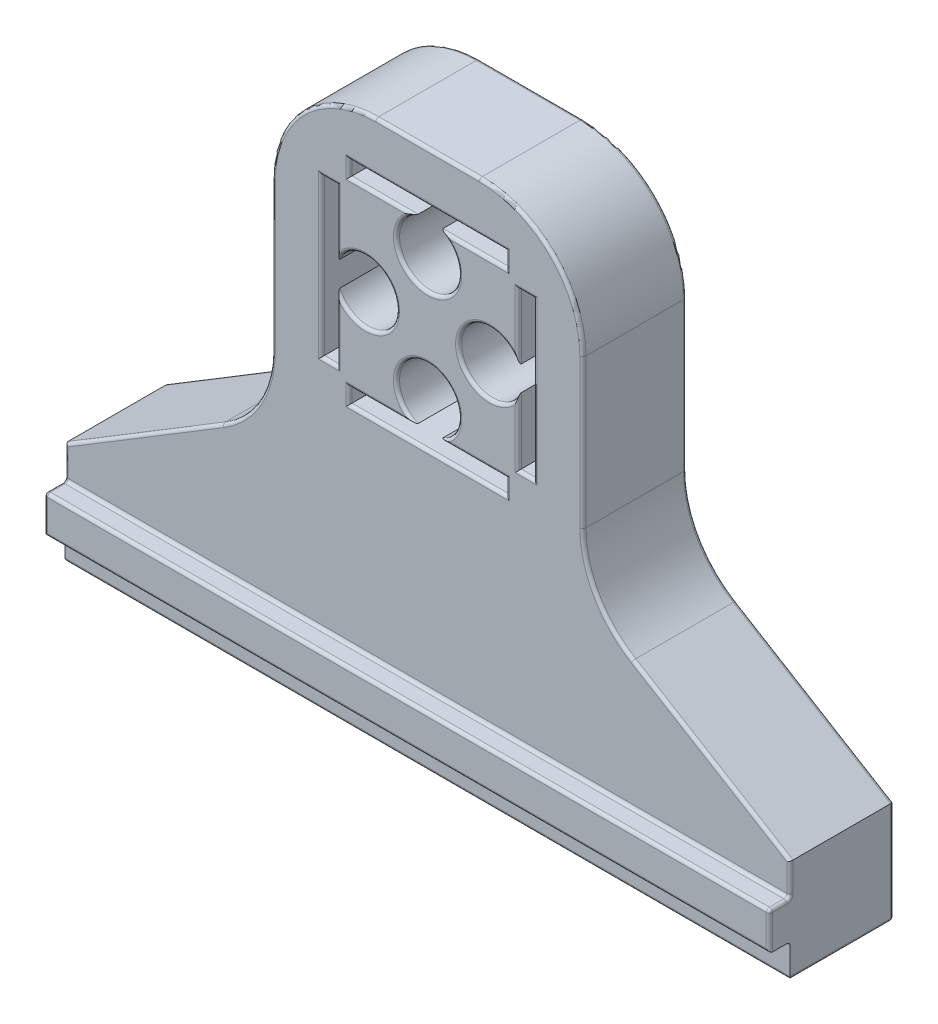
from build123d import *

# Parameters (mm, degrees)
BOSS_EXTRUDE1_DEPTH = 5
BOSS_EXTRUDE2_START = -2
SKETCH4_R           = 2
BOSS_EXTRUDE2_DEPTH = 2
FILLET1_R           = 10
BOSS_EXTRUDE3_DEPTH = 70
FILLET2_R           = 0.3
BOSS_EXTRUDE4_START = 8
BOSS_EXTRUDE4_DEPTH = 8
FILLET3_R           = 0.3
FILLET4_R           = 0.3
FILLET5_R           = 0.3


with BuildPart() as part:
    # Sketch3 → Boss-Extrude1 (new, symmetric)
    with BuildSketch(Plane.XY):
        Polygon((-35, -37.05), (-35, -27.15), (-15, -15), (-15, 15), (15, 15), (15, -15), (35, -27.15), (35, -37.05), align=None)
        with BuildLine():
            ThreePointArc((-8.65, -1.608570794), (-2.9, 0), (-8.65, 1.608570794))
            Line((-8.65, 1.608570794), (-8.65, 7.69))
            Line((-8.65, 7.69), (-10.35, 7.69))
            Line((-10.35, 7.69), (-10.35, -7.69))
            Line((-10.35, -7.69), (-8.65, -7.69))
            Line((-8.65, -7.69), (-8.65, -1.608570794))
        make_face(mode=Mode.SUBTRACT)
        with BuildLine():
            ThreePointArc((-1.608570794, 8.65), (0, 2.9), (1.608570794, 8.65))
            Line((1.608570794, 8.65), (7.69, 8.65))
            Line((7.69, 8.65), (7.69, 10.35))
            Line((7.69, 10.35), (-7.69, 10.35))
            Line((-7.69, 10.35), (-7.69, 8.65))
            Line((-7.69, 8.65), (-1.608570794, 8.65))
        make_face(mode=Mode.SUBTRACT)
        with BuildLine():
            ThreePointArc((8.65, 1.608570794), (2.9, 0), (8.65, -1.608570794))
            Line((8.65, -1.608570794), (8.65, -7.69))
            Line((8.65, -7.69), (10.35, -7.69))
            Line((10.35, -7.69), (10.35, 7.69))
            Line((10.35, 7.69), (8.65, 7.69))
            Line((8.65, 7.69), (8.65, 1.608570794))
        make_face(mode=Mode.SUBTRACT)
        with BuildLine():
            ThreePointArc((1.608570794, -8.65), (0, -2.9), (-1.608570794, -8.65))
            Line((-1.608570794, -8.65), (-7.69, -8.65))
            Line((-7.69, -8.65), (-7.69, -10.35))
            Line((-7.69, -10.35), (7.69, -10.35))
            Line((7.69, -10.35), (7.69, -8.65))
            Line((7.69, -8.65), (1.608570794, -8.65))
        make_face(mode=Mode.SUBTRACT)
    extrude(amount=BOSS_EXTRUDE1_DEPTH, both=True)

    # Sketch4 → Boss-Extrude2 (add)
    # profile 1 of 4: a face of its own
    with BuildSketch(Plane(origin=(0, 0, -5), x_dir=(-1, 0, 0), z_dir=(0, 0, -1)).offset(BOSS_EXTRUDE2_START)):
        with BuildLine():
            Line((7.69, -8.65), (1.608570794, -8.65))
            ThreePointArc((1.608570794, -8.65), (0, -2.9), (-1.608570794, -8.65))
            Line((-1.608570794, -8.65), (-7.69, -8.65))
            Line((-7.69, -8.65), (-7.69, -10.35))
            Line((-7.69, -10.35), (7.69, -10.35))
            Line((7.69, -10.35), (7.69, -8.65))
        make_face()
        with Locations((0, -6)):
            Circle(SKETCH4_R, mode=Mode.SUBTRACT)
    # profile 2 of 4: a face of its own
    with BuildSketch(Plane(origin=(0, 0, -5), x_dir=(-1, 0, 0), z_dir=(0, 0, -1)).offset(BOSS_EXTRUDE2_START)):
        with BuildLine():
            Line((8.65, 7.69), (8.65, 1.608570794))
            ThreePointArc((8.65, 1.608570794), (2.9, 0), (8.65, -1.608570794))
            Line((8.65, -1.608570794), (8.65, -7.69))
            Line((8.65, -7.69), (10.35, -7.69))
            Line((10.35, -7.69), (10.35, 7.69))
            Line((10.35, 7.69), (8.65, 7.69))
        make_face()
        with Locations((6, 0)):
            Circle(SKETCH4_R, mode=Mode.SUBTRACT)
    # profile 3 of 4: a face of its own
    with BuildSketch(Plane(origin=(0, 0, -5), x_dir=(-1, 0, 0), z_dir=(0, 0, -1)).offset(BOSS_EXTRUDE2_START)):
        with BuildLine():
            Line((1.608570794, 8.65), (7.69, 8.65))
            Line((7.69, 8.65), (7.69, 10.35))
            Line((7.69, 10.35), (-7.69, 10.35))
            Line((-7.69, 10.35), (-7.69, 8.65))
            Line((-7.69, 8.65), (-1.608570794, 8.65))
            ThreePointArc((-1.608570794, 8.65), (0, 2.9), (1.608570794, 8.65))
        make_face()
        with Locations((0, 6)):
            Circle(SKETCH4_R, mode=Mode.SUBTRACT)
    # profile 4 of 4: a face of its own
    with BuildSketch(Plane(origin=(0, 0, -5), x_dir=(-1, 0, 0), z_dir=(0, 0, -1)).offset(BOSS_EXTRUDE2_START)):
        with BuildLine():
            Line((-8.65, 1.608570794), (-8.65, 7.69))
            Line((-8.65, 7.69), (-10.35, 7.69))
            Line((-10.35, 7.69), (-10.35, -7.69))
            Line((-10.35, -7.69), (-8.65, -7.69))
            Line((-8.65, -7.69), (-8.65, -1.608570794))
            ThreePointArc((-8.65, -1.608570794), (-2.9, 0), (-8.65, 1.608570794))
        make_face()
        with Locations((-6, 0)):
            Circle(SKETCH4_R, mode=Mode.SUBTRACT)
    extrude(amount=BOSS_EXTRUDE2_DEPTH)

    # Fillet1
    fillet1_edges = [part.edges().sort_by_distance(p)[0] for p in [
        (-15, -15, 0),
        (-15, 15, 0),
        (15, 15, 0),
        (15, -15, 0),
    ]]
    fillet(fillet1_edges, radius=FILLET1_R)

    # Sketch5 → Boss-Extrude3 (add)
    with BuildSketch(Plane(origin=(35, 0, 0), x_dir=(0, 0, -1), z_dir=(1, 0, 0))):
        Polygon((-7, -33.85), (-5, -33.85), (-5, -37.05), (4.9, -37.05), (4.9, -27.15), (-5, -27.15), (-5, -30.25), (-7, -30.25), align=None)
    extrude(amount=-BOSS_EXTRUDE3_DEPTH)

    # Fillet2
    fillet2_edges = [part.edges().sort_by_distance(p)[0] for p in [
        (35, -32.05, 7),
        (0, -33.85, 5),
        (0, -30.25, 5),
        (0, -30.25, 7),
        (-35, -32.05, 7),
        (0, -33.85, 7),
    ]]
    fillet(fillet2_edges, radius=FILLET2_R)

    # Sketch6 → Boss-Extrude4 (add)
    # profile 1 of 4: a face of its own
    with BuildSketch(Plane.XY.offset(-3).offset(BOSS_EXTRUDE4_START)):
        with BuildLine():
            Line((1.608570794, -8.65), (7.69, -8.65))
            Line((7.69, -8.65), (7.69, -10.35))
            Line((7.69, -10.35), (-7.69, -10.35))
            Line((-7.69, -10.35), (-7.69, -8.65))
            Line((-7.69, -8.65), (-1.608570794, -8.65))
            ThreePointArc((-1.608570794, -8.65), (0, -2.9), (1.608570794, -8.65))
        make_face()
        with BuildLine():
            Line((7.59, -8.75), (1.198957881, -8.75))
            ThreePointArc((1.198957881, -8.75), (0, -3), (-1.198957881, -8.75))
            Line((-1.198957881, -8.75), (-7.59, -8.75))
            Line((-7.59, -8.75), (-7.59, -10.25))
            Line((-7.59, -10.25), (7.59, -10.25))
            Line((7.59, -10.25), (7.59, -8.75))
        make_face(mode=Mode.SUBTRACT)
    # profile 2 of 4: a face of its own
    with BuildSketch(Plane.XY.offset(-3).offset(BOSS_EXTRUDE4_START)):
        with BuildLine():
            Line((10.35, 7.69), (8.65, 7.69))
            Line((8.65, 7.69), (8.65, 1.608570794))
            ThreePointArc((8.65, 1.608570794), (2.9, 0), (8.65, -1.608570794))
            Line((8.65, -1.608570794), (8.65, -7.69))
            Line((8.65, -7.69), (10.35, -7.69))
            Line((10.35, -7.69), (10.35, 7.69))
        make_face()
        with BuildLine():
            Line((8.75, 7.59), (8.75, 1.198957881))
            ThreePointArc((8.75, 1.198957881), (3, 0), (8.75, -1.198957881))
            Line((8.75, -1.198957881), (8.75, -7.59))
            Line((8.75, -7.59), (10.25, -7.59))
            Line((10.25, -7.59), (10.25, 7.59))
            Line((10.25, 7.59), (8.75, 7.59))
        make_face(mode=Mode.SUBTRACT)
    # profile 3 of 4: a face of its own
    with BuildSketch(Plane.XY.offset(-3).offset(BOSS_EXTRUDE4_START)):
        with BuildLine():
            Line((7.69, 10.35), (-7.69, 10.35))
            Line((-7.69, 10.35), (-7.69, 8.65))
            Line((-7.69, 8.65), (-1.608570794, 8.65))
            ThreePointArc((-1.608570794, 8.65), (0, 2.9), (1.608570794, 8.65))
            Line((1.608570794, 8.65), (7.69, 8.65))
            Line((7.69, 8.65), (7.69, 10.35))
        make_face()
        with BuildLine():
            Line((-7.59, 8.75), (-1.198957881, 8.75))
            ThreePointArc((-1.198957881, 8.75), (0, 3), (1.198957881, 8.75))
            Line((1.198957881, 8.75), (7.59, 8.75))
            Line((7.59, 8.75), (7.59, 10.25))
            Line((7.59, 10.25), (-7.59, 10.25))
            Line((-7.59, 10.25), (-7.59, 8.75))
        make_face(mode=Mode.SUBTRACT)
    # profile 4 of 4: a face of its own
    with BuildSketch(Plane.XY.offset(-3).offset(BOSS_EXTRUDE4_START)):
        with BuildLine():
            Line((-8.65, 7.69), (-10.35, 7.69))
            Line((-10.35, 7.69), (-10.35, -7.69))
            Line((-10.35, -7.69), (-8.65, -7.69))
            Line((-8.65, -7.69), (-8.65, -1.608570794))
            ThreePointArc((-8.65, -1.608570794), (-2.9, 0), (-8.65, 1.608570794))
            Line((-8.65, 1.608570794), (-8.65, 7.69))
        make_face()
        with BuildLine():
            Line((-8.75, -7.59), (-8.75, -1.198957881))
            ThreePointArc((-8.75, -1.198957881), (-3, 0), (-8.75, 1.198957881))
            Line((-8.75, 1.198957881), (-8.75, 7.59))
            Line((-8.75, 7.59), (-10.25, 7.59))
            Line((-10.25, 7.59), (-10.25, -7.59))
            Line((-10.25, -7.59), (-8.75, -7.59))
        make_face(mode=Mode.SUBTRACT)
    extrude(amount=-BOSS_EXTRUDE4_DEPTH)

    # Fillet3
    fillet3_edges = [part.edges().sort_by_distance(p)[0] for p in [
        (0, -37.05, 5),
        (0, -37.05, -5),
        (35, -37.05, 0),
        (-35, -37.05, 0),
    ]]
    fillet(fillet3_edges, radius=FILLET3_R)

    # Fillet4
    # the kernel refuses this fillet: 0.3 mm, written as the material it takes off along each edge
    with BuildSketch(Plane(origin=(34.7, -36.75, -4.7), x_dir=(0, 0, -1), z_dir=(1, 0, 0))) as fillet4_piece_1_section:
        Polygon((0, 0), (FILLET4_R, 0), (FILLET4_R, -FILLET4_R), (0, -FILLET4_R), align=None)
    fillet4_piece_1 = extrude(amount=FILLET4_R, mode=Mode.PRIVATE)
    fillet4_piece_1 = fillet4_piece_1 - Plane(origin=(34.7, -36.75, -4.7), x_dir=(0, 0.7071067811865475, 0.7071067811865475), z_dir=(1, 0, 0)) * Sphere(FILLET4_R, mode=Mode.PRIVATE)
    add(fillet4_piece_1, mode=Mode.SUBTRACT)
    with BuildSketch(Plane(origin=(-34.7, -36.75, -4.7), x_dir=(-1, 0, 0), z_dir=(0, 0, -1))) as fillet4_piece_2_section:
        Polygon((0, 0), (FILLET4_R, 0), (FILLET4_R, -FILLET4_R), (0, -FILLET4_R), align=None)
    fillet4_piece_2 = extrude(amount=FILLET4_R, mode=Mode.PRIVATE)
    fillet4_piece_2 = fillet4_piece_2 - Plane(origin=(-34.7, -36.75, -4.7), x_dir=(0.7071067811865474, 0.7071067811865476, 0), z_dir=(0, 0, -1)) * Sphere(FILLET4_R, mode=Mode.PRIVATE)
    add(fillet4_piece_2, mode=Mode.SUBTRACT)
    with BuildSketch(Plane(origin=(0, -6, -5), x_dir=(-1, 0, 0), z_dir=(0, -1, 0))) as fillet4_piece_3:
        with BuildLine():
            CenterArc((2 + FILLET4_R, -FILLET4_R), FILLET4_R, 90, 90)
            Line((2, -FILLET4_R), (2, 0))
            Line((2, 0), (2 + FILLET4_R, 0))
        make_face()
    revolve(axis=Axis((0, -6, -5), (0, 0, -1)), mode=Mode.SUBTRACT)
    with BuildSketch(Plane(origin=(-6, 0, -5), x_dir=(-1, 0, 0), z_dir=(0, -1, 0))) as fillet4_piece_4:
        with BuildLine():
            CenterArc((2 + FILLET4_R, -FILLET4_R), FILLET4_R, 90, 90)
            Line((2, -FILLET4_R), (2, 0))
            Line((2, 0), (2 + FILLET4_R, 0))
        make_face()
    revolve(axis=Axis((-6, 0, -5), (0, 0, -1)), mode=Mode.SUBTRACT)
    with BuildSketch(Plane(origin=(0, 6, -5), x_dir=(-1, 0, 0), z_dir=(0, -1, 0))) as fillet4_piece_5:
        with BuildLine():
            CenterArc((2 + FILLET4_R, -FILLET4_R), FILLET4_R, 90, 90)
            Line((2, -FILLET4_R), (2, 0))
            Line((2, 0), (2 + FILLET4_R, 0))
        make_face()
    revolve(axis=Axis((0, 6, -5), (0, 0, -1)), mode=Mode.SUBTRACT)
    with BuildSketch(Plane(origin=(6, 0, -5), x_dir=(-1, 0, 0), z_dir=(0, -1, 0))) as fillet4_piece_6:
        with BuildLine():
            CenterArc((2 + FILLET4_R, -FILLET4_R), FILLET4_R, 90, 90)
            Line((2, -FILLET4_R), (2, 0))
            Line((2, 0), (2 + FILLET4_R, 0))
        make_face()
    revolve(axis=Axis((6, 0, -5), (0, 0, -1)), mode=Mode.SUBTRACT)
    with BuildSketch(Plane(origin=(15, 5, -5), x_dir=(-1, 0, 0), z_dir=(0, -1, 0)), Plane(origin=(-15, -9.374332284, -5), x_dir=(1, 0, 0), z_dir=(0, 1, 0))) as fillet4_piece_7:
        with BuildLine():
            CenterArc((FILLET4_R, -FILLET4_R), FILLET4_R, 90, 90)
            Line((0, -FILLET4_R), (0, 0))
            Line((0, 0), (FILLET4_R, 0))
        make_face()
    extrude(amount=14.374332284, mode=Mode.SUBTRACT)
    with BuildSketch(Plane(origin=(19.807988614, -17.920853083, -5), x_dir=(-0.5192011385553836, -0.854652079926559, 0), z_dir=(0.854652079926559, -0.5192011385553836, 0)), Plane(origin=(-35.64098906, -27.539400854, -5), x_dir=(0.5192011385553845, -0.8546520799265585, 0), z_dir=(0.8546520799265585, 0.5192011385553845, 0))) as fillet4_piece_8:
        with BuildLine():
            CenterArc((FILLET4_R, -FILLET4_R), FILLET4_R, 90, 90)
            Line((0, -FILLET4_R), (0, 0))
            Line((0, 0), (FILLET4_R, 0))
        make_face()
    extrude(amount=18.525667716, mode=Mode.SUBTRACT)
    with BuildSketch(Plane(origin=(-5, 15, -5), x_dir=(0, -1, 0), z_dir=(1, 0, 0))) as fillet4_piece_9:
        with BuildLine():
            CenterArc((FILLET4_R, -FILLET4_R), FILLET4_R, 90, 90)
            Line((0, -FILLET4_R), (0, 0))
            Line((0, 0), (FILLET4_R, 0))
        make_face()
    extrude(amount=10, mode=Mode.SUBTRACT)
    with BuildSketch(Plane(origin=(-5, 5, -5), x_dir=(-1, 0, 0), z_dir=(0, -1, 0))) as fillet4_piece_10:
        with BuildLine():
            CenterArc((10 - FILLET4_R, -FILLET4_R), FILLET4_R, 360, 90)
            Line((10, -FILLET4_R), (10, 0))
            Line((10, 0), (10 - FILLET4_R, 0))
        make_face()
    revolve(axis=Axis((-5, 5, -5), (0, 0, -1)), revolution_arc=90, mode=Mode.SUBTRACT)
    with BuildSketch(Plane(origin=(5, 5, -5), x_dir=(0, 1, 0), z_dir=(-1, 0, 0))) as fillet4_piece_11:
        with BuildLine():
            CenterArc((10 - FILLET4_R, -FILLET4_R), FILLET4_R, 360, 90)
            Line((10, -FILLET4_R), (10, 0))
            Line((10, 0), (10 - FILLET4_R, 0))
        make_face()
    revolve(axis=Axis((5, 5, -5), (0, 0, -1)), revolution_arc=90, mode=Mode.SUBTRACT)
    with BuildSketch(Plane(origin=(25, -9.374332284, -5), x_dir=(-1, 0, 0), z_dir=(0, 1, 0))) as fillet4_piece_12:
        with BuildLine():
            CenterArc((10 + FILLET4_R, FILLET4_R), FILLET4_R, 180, 90)
            Line((10, FILLET4_R), (10, 0))
            Line((10, 0), (10 + FILLET4_R, 0))
        make_face()
    revolve(axis=Axis((25, -9.374332284, -5), (0, 0, 1)), revolution_arc=58.721319306, mode=Mode.SUBTRACT)
    with BuildSketch(Plane(origin=(-25, -9.374332284, -5), x_dir=(0.5192011385553847, -0.8546520799265582, 0), z_dir=(-0.8546520799265582, -0.5192011385553847, 0))) as fillet4_piece_13:
        with BuildLine():
            CenterArc((10 + FILLET4_R, FILLET4_R), FILLET4_R, 180, 90)
            Line((10, FILLET4_R), (10, 0))
            Line((10, 0), (10 + FILLET4_R, 0))
        make_face()
    revolve(axis=Axis((-25, -9.374332284, -5), (0, 0, 1)), revolution_arc=58.721319306, mode=Mode.SUBTRACT)
    with BuildSketch(Plane(origin=(35, -26.4, -5), x_dir=(0, 0, 1), z_dir=(0, -1, 0))) as fillet4_piece_14:
        with BuildLine():
            CenterArc((FILLET4_R, FILLET4_R), FILLET4_R, 180, 90)
            Line((0, FILLET4_R), (0, 0))
            Line((0, 0), (FILLET4_R, 0))
        make_face()
    extrude(amount=10.35, mode=Mode.SUBTRACT)
    with BuildSketch(Plane(origin=(-35, -36.75, -5), x_dir=(1, 0, 0), z_dir=(0, 1, 0))) as fillet4_piece_15:
        with BuildLine():
            CenterArc((FILLET4_R, -FILLET4_R), FILLET4_R, 90, 90)
            Line((0, -FILLET4_R), (0, 0))
            Line((0, 0), (FILLET4_R, 0))
        make_face()
    extrude(amount=10.35, mode=Mode.SUBTRACT)

    # Fillet5
    # the kernel refuses this fillet: 0.3 mm, written as the material it takes off along each edge
    with BuildSketch(Plane(origin=(-34.7, -30.55, 6.7), x_dir=(-1, 0, 0), z_dir=(0, 1, 0))) as fillet5_piece_1_section:
        Polygon((0, 0), (FILLET5_R, 0), (FILLET5_R, FILLET5_R), (0, FILLET5_R), align=None)
    fillet5_piece_1 = extrude(amount=FILLET5_R, mode=Mode.PRIVATE)
    fillet5_piece_1 = fillet5_piece_1 - Plane(origin=(-34.7, -30.55, 6.7), x_dir=(0.7071067811865475, 2.093456611578341e-15, -0.7071067811865475), z_dir=(0, 1, 0)) * Sphere(FILLET5_R, mode=Mode.PRIVATE)
    add(fillet5_piece_1, mode=Mode.SUBTRACT)
    with BuildSketch(Plane(origin=(34.7, -30.55, 6.7), x_dir=(0, 1, 0), z_dir=(1, 0, 0))) as fillet5_piece_2_section:
        Polygon((0, 0), (FILLET5_R, 0), (FILLET5_R, FILLET5_R), (0, FILLET5_R), align=None)
    fillet5_piece_2 = extrude(amount=FILLET5_R, mode=Mode.PRIVATE)
    fillet5_piece_2 = fillet5_piece_2 - Plane(origin=(34.7, -30.55, 6.7), x_dir=(0, -0.7071067811865439, -0.707106781186551), z_dir=(1, 0, 0)) * Sphere(FILLET5_R, mode=Mode.PRIVATE)
    add(fillet5_piece_2, mode=Mode.SUBTRACT)
    with BuildSketch(Plane(origin=(35, -26.4, 5), x_dir=(0, 0, -1), z_dir=(0, -1, 0))) as fillet5_piece_3:
        with BuildLine():
            CenterArc((FILLET5_R, -FILLET5_R), FILLET5_R, 90, 90)
            Line((0, -FILLET5_R), (0, 0))
            Line((0, 0), (FILLET5_R, 0))
        make_face()
    extrude(amount=3.55, mode=Mode.SUBTRACT)
    with BuildSketch(Plane(origin=(15, 5, 5), x_dir=(-1, 0, 0), z_dir=(0, -1, 0)), Plane(origin=(-15, -9.374332284, 5), x_dir=(1, 0, 0), z_dir=(0, 1, 0))) as fillet5_piece_4:
        with BuildLine():
            CenterArc((FILLET5_R, FILLET5_R), FILLET5_R, 180, 90)
            Line((0, FILLET5_R), (0, 0))
            Line((0, 0), (FILLET5_R, 0))
        make_face()
    extrude(amount=14.374332284, mode=Mode.SUBTRACT)
    with BuildSketch(Plane(origin=(19.807988614, -17.920853083, 5), x_dir=(0, 0, -1), z_dir=(0.854652079926559, -0.5192011385553836, 0))) as fillet5_piece_5:
        with BuildLine():
            CenterArc((FILLET5_R, -FILLET5_R), FILLET5_R, 90, 90)
            Line((0, -FILLET5_R), (0, 0))
            Line((0, 0), (FILLET5_R, 0))
        make_face()
    extrude(amount=18.525667716, mode=Mode.SUBTRACT)
    with BuildSketch(Plane(origin=(-5, 15, 5), x_dir=(0, -1, 0), z_dir=(1, 0, 0))) as fillet5_piece_6:
        with BuildLine():
            CenterArc((FILLET5_R, FILLET5_R), FILLET5_R, 180, 90)
            Line((0, FILLET5_R), (0, 0))
            Line((0, 0), (FILLET5_R, 0))
        make_face()
    extrude(amount=10, mode=Mode.SUBTRACT)
    with BuildSketch(Plane(origin=(-35.64098906, -27.539400854, 5), x_dir=(0.5192011385553845, -0.8546520799265585, 0), z_dir=(0.8546520799265585, 0.5192011385553845, 0))) as fillet5_piece_7:
        with BuildLine():
            CenterArc((FILLET5_R, FILLET5_R), FILLET5_R, 180, 90)
            Line((0, FILLET5_R), (0, 0))
            Line((0, 0), (FILLET5_R, 0))
        make_face()
    extrude(amount=18.525667716, mode=Mode.SUBTRACT)
    with BuildSketch(Plane(origin=(-5, 5, 5), x_dir=(-1, 0, 0), z_dir=(0, -1, 0))) as fillet5_piece_8:
        with BuildLine():
            CenterArc((10 - FILLET5_R, FILLET5_R), FILLET5_R, 270, 90)
            Line((10, FILLET5_R), (10, 0))
            Line((10, 0), (10 - FILLET5_R, 0))
        make_face()
    revolve(axis=Axis((-5, 5, 5), (0, 0, -1)), revolution_arc=90, mode=Mode.SUBTRACT)
    with BuildSketch(Plane(origin=(5, 5, 5), x_dir=(0, 1, 0), z_dir=(-1, 0, 0))) as fillet5_piece_9:
        with BuildLine():
            CenterArc((10 - FILLET5_R, FILLET5_R), FILLET5_R, 270, 90)
            Line((10, FILLET5_R), (10, 0))
            Line((10, 0), (10 - FILLET5_R, 0))
        make_face()
    revolve(axis=Axis((5, 5, 5), (0, 0, -1)), revolution_arc=90, mode=Mode.SUBTRACT)
    with BuildSketch(Plane(origin=(25, -9.374332284, 5), x_dir=(-1, 0, 0), z_dir=(0, 1, 0))) as fillet5_piece_10:
        with BuildLine():
            CenterArc((10 + FILLET5_R, -FILLET5_R), FILLET5_R, 90, 90)
            Line((10, -FILLET5_R), (10, 0))
            Line((10, 0), (10 + FILLET5_R, 0))
        make_face()
    revolve(axis=Axis((25, -9.374332284, 5), (0, 0, 1)), revolution_arc=58.721319306, mode=Mode.SUBTRACT)
    with BuildSketch(Plane(origin=(-25, -9.374332284, 5), x_dir=(0.5192011385553847, -0.8546520799265582, 0), z_dir=(-0.8546520799265582, -0.5192011385553847, 0))) as fillet5_piece_11:
        with BuildLine():
            CenterArc((10 + FILLET5_R, -FILLET5_R), FILLET5_R, 90, 90)
            Line((10, -FILLET5_R), (10, 0))
            Line((10, 0), (10 + FILLET5_R, 0))
        make_face()
    revolve(axis=Axis((-25, -9.374332284, 5), (0, 0, 1)), revolution_arc=58.721319306, mode=Mode.SUBTRACT)
    with BuildSketch(Plane(origin=(35, -30.25, 5.3), x_dir=(0, -1, 0), z_dir=(0, 0, 1)), Plane(origin=(-35, -30.25, 5.3), x_dir=(1, 0, 0), z_dir=(0, 0, 1))) as fillet5_piece_12:
        with BuildLine():
            CenterArc((FILLET5_R, -FILLET5_R), FILLET5_R, 90, 90)
            Line((0, -FILLET5_R), (0, 0))
            Line((0, 0), (FILLET5_R, 0))
        make_face()
    extrude(amount=1.4, mode=Mode.SUBTRACT)
    with BuildSketch(Plane(origin=(-35, -29.95, 5), x_dir=(1, 0, 0), z_dir=(0, 1, 0))) as fillet5_piece_13:
        with BuildLine():
            CenterArc((FILLET5_R, FILLET5_R), FILLET5_R, 180, 90)
            Line((0, FILLET5_R), (0, 0))
            Line((0, 0), (FILLET5_R, 0))
        make_face()
    extrude(amount=3.55, mode=Mode.SUBTRACT)
    with BuildSketch(Plane(origin=(35, -29.95, 5.3), x_dir=(0, 0, -1), z_dir=(0, 1, 0))) as fillet5_piece_14:
        with BuildLine():
            CenterArc((0.3 + FILLET5_R, FILLET5_R), FILLET5_R, 180, 90)
            Line((0.3, FILLET5_R), (0.3, 0))
            Line((0.3, 0), (0.3 + FILLET5_R, 0))
        make_face()
    revolve(axis=Axis((35, -29.95, 5.3), (-1, 0, 0)), revolution_arc=90, mode=Mode.SUBTRACT)
    with BuildSketch(Plane(origin=(-35, -29.95, 5.3), x_dir=(0, 0, -1), z_dir=(0, 1, 0))) as fillet5_piece_15:
        with BuildLine():
            CenterArc((0.3 + FILLET5_R, -FILLET5_R), FILLET5_R, 90, 90)
            Line((0.3 + FILLET5_R, 0), (0.3, 0))
            Line((0.3, 0), (0.3, -FILLET5_R))
        make_face()
    revolve(axis=Axis((-35, -29.95, 5.3), (-1, 0, 0)), revolution_arc=90, mode=Mode.SUBTRACT)
    with BuildSketch(Plane(origin=(-7.59, -10.25, 5), x_dir=(0, -1, 0), z_dir=(1, 0, 0)), Plane(origin=(10.25, -7.59, 5), x_dir=(1, 0, 0), z_dir=(0, 1, 0)), Plane(origin=(7.59, 10.25, 5), x_dir=(0, 1, 0), z_dir=(-1, 0, 0)), Plane(origin=(-10.25, 7.59, 5), x_dir=(-1, 0, 0), z_dir=(0, -1, 0))) as fillet5_piece_16:
        with BuildLine():
            CenterArc((FILLET5_R, FILLET5_R), FILLET5_R, 180, 90)
            Line((0, FILLET5_R), (0, 0))
            Line((0, 0), (FILLET5_R, 0))
        make_face()
    extrude(amount=15.18, mode=Mode.SUBTRACT)
    with BuildSketch(Plane(origin=(-7.59, -8.75, 5), x_dir=(-1, 0, 0), z_dir=(0, -1, 0)), Plane(origin=(7.59, -10.25, 5), x_dir=(1, 0, 0), z_dir=(0, 1, 0)), Plane(origin=(8.75, -7.59, 5), x_dir=(0, -1, 0), z_dir=(1, 0, 0)), Plane(origin=(10.25, 7.59, 5), x_dir=(0, 1, 0), z_dir=(-1, 0, 0)), Plane(origin=(7.59, 8.75, 5), x_dir=(1, 0, 0), z_dir=(0, 1, 0)), Plane(origin=(-7.59, 10.25, 5), x_dir=(-1, 0, 0), z_dir=(0, -1, 0)), Plane(origin=(-8.75, 7.59, 5), x_dir=(0, 1, 0), z_dir=(-1, 0, 0)), Plane(origin=(-10.25, -7.59, 5), x_dir=(0, -1, 0), z_dir=(1, 0, 0))) as fillet5_piece_17:
        with BuildLine():
            CenterArc((FILLET5_R, FILLET5_R), FILLET5_R, 180, 90)
            Line((0, FILLET5_R), (0, 0))
            Line((0, 0), (FILLET5_R, 0))
        make_face()
    extrude(amount=1.5, mode=Mode.SUBTRACT)
    with BuildSketch(Plane(origin=(-0.448957881, -8.75, 5), x_dir=(0, 1, 0), z_dir=(-1, 0, 0)), Plane(origin=(7.59, -8.75, 5), x_dir=(0, 1, 0), z_dir=(-1, 0, 0)), Plane(origin=(8.75, -0.448957881, 5), x_dir=(-1, 0, 0), z_dir=(0, -1, 0)), Plane(origin=(8.75, 7.59, 5), x_dir=(-1, 0, 0), z_dir=(0, -1, 0)), Plane(origin=(0.448957881, 8.75, 5), x_dir=(0, -1, 0), z_dir=(1, 0, 0)), Plane(origin=(-7.59, 8.75, 5), x_dir=(0, -1, 0), z_dir=(1, 0, 0)), Plane(origin=(-8.75, 0.448957881, 5), x_dir=(1, 0, 0), z_dir=(0, 1, 0)), Plane(origin=(-8.75, -7.59, 5), x_dir=(1, 0, 0), z_dir=(0, 1, 0))) as fillet5_piece_18:
        with BuildLine():
            CenterArc((FILLET5_R, FILLET5_R), FILLET5_R, 180, 90)
            Line((0, FILLET5_R), (0, 0))
            Line((0, 0), (FILLET5_R, 0))
        make_face()
    extrude(amount=7.141042119, mode=Mode.SUBTRACT)
    with BuildSketch(Plane(origin=(0, -6, 5), x_dir=(0.15923950976873086, -0.9872399802118096, 0), z_dir=(-0.9872399802118096, -0.15923950976873086, 0))) as fillet5_piece_19:
        with BuildLine():
            CenterArc((3 + FILLET5_R, -FILLET5_R), FILLET5_R, 90, 90)
            Line((3, -FILLET5_R), (3, 0))
            Line((3, 0), (3 + FILLET5_R, 0))
        make_face()
    revolve(axis=Axis((0, -6, 5), (0, 0, 1)), revolution_arc=341.674485166, mode=Mode.SUBTRACT)
    with BuildSketch(Plane(origin=(6, 0, 5), x_dir=(0.987239980211885, 0.15923950976826368, 0), z_dir=(0.15923950976826368, -0.987239980211885, 0))) as fillet5_piece_20:
        with BuildLine():
            CenterArc((3 + FILLET5_R, -FILLET5_R), FILLET5_R, 90, 90)
            Line((3, -FILLET5_R), (3, 0))
            Line((3, 0), (3 + FILLET5_R, 0))
        make_face()
    revolve(axis=Axis((6, 0, 5), (0, 0, 1)), revolution_arc=341.674485166, mode=Mode.SUBTRACT)
    with BuildSketch(Plane(origin=(0, 6, 5), x_dir=(-0.15923950976815257, 0.9872399802119028, 0), z_dir=(0.9872399802119028, 0.15923950976815257, 0))) as fillet5_piece_21:
        with BuildLine():
            CenterArc((3 + FILLET5_R, -FILLET5_R), FILLET5_R, 90, 90)
            Line((3, -FILLET5_R), (3, 0))
            Line((3, 0), (3 + FILLET5_R, 0))
        make_face()
    revolve(axis=Axis((0, 6, 5), (0, 0, 1)), revolution_arc=341.674485166, mode=Mode.SUBTRACT)
    with BuildSketch(Plane(origin=(-6, 0, 5), x_dir=(-0.9872399802118278, -0.1592395097686184, 0), z_dir=(-0.1592395097686184, 0.9872399802118278, 0))) as fillet5_piece_22:
        with BuildLine():
            CenterArc((3 + FILLET5_R, -FILLET5_R), FILLET5_R, 90, 90)
            Line((3, -FILLET5_R), (3, 0))
            Line((3, 0), (3 + FILLET5_R, 0))
        make_face()
    revolve(axis=Axis((-6, 0, 5), (0, 0, 1)), revolution_arc=341.674485166, mode=Mode.SUBTRACT)
    with BuildSketch(Plane(origin=(-7.59, -8.75, 5), x_dir=(-1, 0, 0), z_dir=(0, -1, 0))) as fillet5_piece_23a_section:
        with BuildLine():
            CenterArc((FILLET5_R, FILLET5_R), FILLET5_R, 180, 90)
            Line((0, FILLET5_R), (0, 0))
            Line((0, 0), (FILLET5_R, 0))
        make_face()
    fillet5_piece_23a = extrude(amount=2.25, mode=Mode.PRIVATE)
    fillet5_piece_23a = split(fillet5_piece_23a, bisect_by=Plane(origin=(-7.657918534, -10.25, 4.932081466), z_dir=(0, -1, 0)), keep=Keep.TOP, mode=Mode.PRIVATE)
    with BuildSketch(Plane(origin=(-8.34, -10.25, 5), x_dir=(0, -1, 0), z_dir=(1, 0, 0))) as fillet5_piece_23b_section:
        with BuildLine():
            CenterArc((FILLET5_R, FILLET5_R), FILLET5_R, 180, 90)
            Line((0, FILLET5_R), (0, 0))
            Line((0, 0), (FILLET5_R, 0))
        make_face()
    fillet5_piece_23b = extrude(amount=15.93, mode=Mode.PRIVATE)
    fillet5_piece_23b = split(fillet5_piece_23b, bisect_by=Plane(origin=(-7.59, -10.317918534, 4.932081466), z_dir=(-1, 0, 0)), keep=Keep.TOP, mode=Mode.PRIVATE)
    fillet5_piece_23 = fillet5_piece_23a & fillet5_piece_23b
    add(fillet5_piece_23, mode=Mode.SUBTRACT)
    with BuildSketch(Plane(origin=(-7.59, -10.25, 5), x_dir=(0, -1, 0), z_dir=(1, 0, 0))) as fillet5_piece_24a_section:
        with BuildLine():
            CenterArc((FILLET5_R, FILLET5_R), FILLET5_R, 180, 90)
            Line((0, FILLET5_R), (0, 0))
            Line((0, 0), (FILLET5_R, 0))
        make_face()
    fillet5_piece_24a = extrude(amount=15.93, mode=Mode.PRIVATE)
    fillet5_piece_24a = split(fillet5_piece_24a, bisect_by=Plane(origin=(7.59, -10.317918534, 4.932081466), z_dir=(1, 0, 0)), keep=Keep.TOP, mode=Mode.PRIVATE)
    with BuildSketch(Plane(origin=(7.59, -11, 5), x_dir=(1, 0, 0), z_dir=(0, 1, 0))) as fillet5_piece_24b_section:
        with BuildLine():
            CenterArc((FILLET5_R, FILLET5_R), FILLET5_R, 180, 90)
            Line((0, FILLET5_R), (0, 0))
            Line((0, 0), (FILLET5_R, 0))
        make_face()
    fillet5_piece_24b = extrude(amount=2.25, mode=Mode.PRIVATE)
    fillet5_piece_24b = split(fillet5_piece_24b, bisect_by=Plane(origin=(7.657918534, -10.25, 4.932081466), z_dir=(0, -1, 0)), keep=Keep.TOP, mode=Mode.PRIVATE)
    fillet5_piece_24 = fillet5_piece_24a & fillet5_piece_24b
    add(fillet5_piece_24, mode=Mode.SUBTRACT)
    with BuildSketch(Plane(origin=(-0.448957881, -8.75, 5), x_dir=(0, 1, 0), z_dir=(-1, 0, 0))) as fillet5_piece_25a_section:
        with BuildLine():
            CenterArc((FILLET5_R, FILLET5_R), FILLET5_R, 180, 90)
            Line((0, FILLET5_R), (0, 0))
            Line((0, 0), (FILLET5_R, 0))
        make_face()
    fillet5_piece_25a = extrude(amount=7.891042119, mode=Mode.PRIVATE)
    fillet5_piece_25a = split(fillet5_piece_25a, bisect_by=Plane(origin=(-7.59, -8.682081466, 4.932081466), z_dir=(-1, 0, 0)), keep=Keep.TOP, mode=Mode.PRIVATE)
    with BuildSketch(Plane(origin=(-7.59, -8, 5), x_dir=(-1, 0, 0), z_dir=(0, -1, 0))) as fillet5_piece_25b_section:
        with BuildLine():
            CenterArc((FILLET5_R, FILLET5_R), FILLET5_R, 180, 90)
            Line((0, FILLET5_R), (0, 0))
            Line((0, 0), (FILLET5_R, 0))
        make_face()
    fillet5_piece_25b = extrude(amount=2.25, mode=Mode.PRIVATE)
    fillet5_piece_25b = split(fillet5_piece_25b, bisect_by=Plane(origin=(-7.657918534, -8.75, 4.932081466), z_dir=(0, 1, 0)), keep=Keep.TOP, mode=Mode.PRIVATE)
    fillet5_piece_25 = fillet5_piece_25a & fillet5_piece_25b
    add(fillet5_piece_25, mode=Mode.SUBTRACT)
    with BuildSketch(Plane(origin=(8.34, -8.75, 5), x_dir=(0, 1, 0), z_dir=(-1, 0, 0))) as fillet5_piece_26a_section:
        with BuildLine():
            CenterArc((FILLET5_R, FILLET5_R), FILLET5_R, 180, 90)
            Line((0, FILLET5_R), (0, 0))
            Line((0, 0), (FILLET5_R, 0))
        make_face()
    fillet5_piece_26a = extrude(amount=7.891042119, mode=Mode.PRIVATE)
    fillet5_piece_26a = split(fillet5_piece_26a, bisect_by=Plane(origin=(7.59, -8.682081466, 4.932081466), z_dir=(1, 0, 0)), keep=Keep.TOP, mode=Mode.PRIVATE)
    with BuildSketch(Plane(origin=(7.59, -10.25, 5), x_dir=(1, 0, 0), z_dir=(0, 1, 0))) as fillet5_piece_26b_section:
        with BuildLine():
            CenterArc((FILLET5_R, FILLET5_R), FILLET5_R, 180, 90)
            Line((0, FILLET5_R), (0, 0))
            Line((0, 0), (FILLET5_R, 0))
        make_face()
    fillet5_piece_26b = extrude(amount=2.25, mode=Mode.PRIVATE)
    fillet5_piece_26b = split(fillet5_piece_26b, bisect_by=Plane(origin=(7.657918534, -8.75, 4.932081466), z_dir=(0, 1, 0)), keep=Keep.TOP, mode=Mode.PRIVATE)
    fillet5_piece_26 = fillet5_piece_26a & fillet5_piece_26b
    add(fillet5_piece_26, mode=Mode.SUBTRACT)
    with BuildSketch(Plane(origin=(10.25, -8.34, 5), x_dir=(1, 0, 0), z_dir=(0, 1, 0))) as fillet5_piece_27a_section:
        with BuildLine():
            CenterArc((FILLET5_R, FILLET5_R), FILLET5_R, 180, 90)
            Line((0, FILLET5_R), (0, 0))
            Line((0, 0), (FILLET5_R, 0))
        make_face()
    fillet5_piece_27a = extrude(amount=15.93, mode=Mode.PRIVATE)
    fillet5_piece_27a = split(fillet5_piece_27a, bisect_by=Plane(origin=(10.317918534, -7.59, 4.932081466), z_dir=(0, -1, 0)), keep=Keep.TOP, mode=Mode.PRIVATE)
    with BuildSketch(Plane(origin=(8.75, -7.59, 5), x_dir=(0, -1, 0), z_dir=(1, 0, 0))) as fillet5_piece_27b_section:
        with BuildLine():
            CenterArc((FILLET5_R, FILLET5_R), FILLET5_R, 180, 90)
            Line((0, FILLET5_R), (0, 0))
            Line((0, 0), (FILLET5_R, 0))
        make_face()
    fillet5_piece_27b = extrude(amount=2.25, mode=Mode.PRIVATE)
    fillet5_piece_27b = split(fillet5_piece_27b, bisect_by=Plane(origin=(10.25, -7.657918534, 4.932081466), z_dir=(1, 0, 0)), keep=Keep.TOP, mode=Mode.PRIVATE)
    fillet5_piece_27 = fillet5_piece_27a & fillet5_piece_27b
    add(fillet5_piece_27, mode=Mode.SUBTRACT)
    with BuildSketch(Plane(origin=(10.25, -7.59, 5), x_dir=(1, 0, 0), z_dir=(0, 1, 0))) as fillet5_piece_28a_section:
        with BuildLine():
            CenterArc((FILLET5_R, FILLET5_R), FILLET5_R, 180, 90)
            Line((0, FILLET5_R), (0, 0))
            Line((0, 0), (FILLET5_R, 0))
        make_face()
    fillet5_piece_28a = extrude(amount=15.93, mode=Mode.PRIVATE)
    fillet5_piece_28a = split(fillet5_piece_28a, bisect_by=Plane(origin=(10.317918534, 7.59, 4.932081466), z_dir=(0, 1, 0)), keep=Keep.TOP, mode=Mode.PRIVATE)
    with BuildSketch(Plane(origin=(11, 7.59, 5), x_dir=(0, 1, 0), z_dir=(-1, 0, 0))) as fillet5_piece_28b_section:
        with BuildLine():
            CenterArc((FILLET5_R, FILLET5_R), FILLET5_R, 180, 90)
            Line((0, FILLET5_R), (0, 0))
            Line((0, 0), (FILLET5_R, 0))
        make_face()
    fillet5_piece_28b = extrude(amount=2.25, mode=Mode.PRIVATE)
    fillet5_piece_28b = split(fillet5_piece_28b, bisect_by=Plane(origin=(10.25, 7.657918534, 4.932081466), z_dir=(1, 0, 0)), keep=Keep.TOP, mode=Mode.PRIVATE)
    fillet5_piece_28 = fillet5_piece_28a & fillet5_piece_28b
    add(fillet5_piece_28, mode=Mode.SUBTRACT)
    with BuildSketch(Plane(origin=(8.75, -0.448957881, 5), x_dir=(-1, 0, 0), z_dir=(0, -1, 0))) as fillet5_piece_29a_section:
        with BuildLine():
            CenterArc((FILLET5_R, FILLET5_R), FILLET5_R, 180, 90)
            Line((0, FILLET5_R), (0, 0))
            Line((0, 0), (FILLET5_R, 0))
        make_face()
    fillet5_piece_29a = extrude(amount=7.891042119, mode=Mode.PRIVATE)
    fillet5_piece_29a = split(fillet5_piece_29a, bisect_by=Plane(origin=(8.682081466, -7.59, 4.932081466), z_dir=(0, -1, 0)), keep=Keep.TOP, mode=Mode.PRIVATE)
    with BuildSketch(Plane(origin=(8, -7.59, 5), x_dir=(0, -1, 0), z_dir=(1, 0, 0))) as fillet5_piece_29b_section:
        with BuildLine():
            CenterArc((FILLET5_R, FILLET5_R), FILLET5_R, 180, 90)
            Line((0, FILLET5_R), (0, 0))
            Line((0, 0), (FILLET5_R, 0))
        make_face()
    fillet5_piece_29b = extrude(amount=2.25, mode=Mode.PRIVATE)
    fillet5_piece_29b = split(fillet5_piece_29b, bisect_by=Plane(origin=(8.75, -7.657918534, 4.932081466), z_dir=(-1, 0, 0)), keep=Keep.TOP, mode=Mode.PRIVATE)
    fillet5_piece_29 = fillet5_piece_29a & fillet5_piece_29b
    add(fillet5_piece_29, mode=Mode.SUBTRACT)
    with BuildSketch(Plane(origin=(10.25, 7.59, 5), x_dir=(0, 1, 0), z_dir=(-1, 0, 0))) as fillet5_piece_30a_section:
        with BuildLine():
            CenterArc((FILLET5_R, FILLET5_R), FILLET5_R, 180, 90)
            Line((0, FILLET5_R), (0, 0))
            Line((0, 0), (FILLET5_R, 0))
        make_face()
    fillet5_piece_30a = extrude(amount=2.25, mode=Mode.PRIVATE)
    fillet5_piece_30a = split(fillet5_piece_30a, bisect_by=Plane(origin=(8.75, 7.657918534, 4.932081466), z_dir=(-1, 0, 0)), keep=Keep.TOP, mode=Mode.PRIVATE)
    with BuildSketch(Plane(origin=(8.75, 8.34, 5), x_dir=(-1, 0, 0), z_dir=(0, -1, 0))) as fillet5_piece_30b_section:
        with BuildLine():
            CenterArc((FILLET5_R, FILLET5_R), FILLET5_R, 180, 90)
            Line((0, FILLET5_R), (0, 0))
            Line((0, 0), (FILLET5_R, 0))
        make_face()
    fillet5_piece_30b = extrude(amount=7.891042119, mode=Mode.PRIVATE)
    fillet5_piece_30b = split(fillet5_piece_30b, bisect_by=Plane(origin=(8.682081466, 7.59, 4.932081466), z_dir=(0, 1, 0)), keep=Keep.TOP, mode=Mode.PRIVATE)
    fillet5_piece_30 = fillet5_piece_30a & fillet5_piece_30b
    add(fillet5_piece_30, mode=Mode.SUBTRACT)
    with BuildSketch(Plane(origin=(7.59, 8.75, 5), x_dir=(1, 0, 0), z_dir=(0, 1, 0))) as fillet5_piece_31a_section:
        with BuildLine():
            CenterArc((FILLET5_R, FILLET5_R), FILLET5_R, 180, 90)
            Line((0, FILLET5_R), (0, 0))
            Line((0, 0), (FILLET5_R, 0))
        make_face()
    fillet5_piece_31a = extrude(amount=2.25, mode=Mode.PRIVATE)
    fillet5_piece_31a = split(fillet5_piece_31a, bisect_by=Plane(origin=(7.657918534, 10.25, 4.932081466), z_dir=(0, 1, 0)), keep=Keep.TOP, mode=Mode.PRIVATE)
    with BuildSketch(Plane(origin=(8.34, 10.25, 5), x_dir=(0, 1, 0), z_dir=(-1, 0, 0))) as fillet5_piece_31b_section:
        with BuildLine():
            CenterArc((FILLET5_R, FILLET5_R), FILLET5_R, 180, 90)
            Line((0, FILLET5_R), (0, 0))
            Line((0, 0), (FILLET5_R, 0))
        make_face()
    fillet5_piece_31b = extrude(amount=15.93, mode=Mode.PRIVATE)
    fillet5_piece_31b = split(fillet5_piece_31b, bisect_by=Plane(origin=(7.59, 10.317918534, 4.932081466), z_dir=(1, 0, 0)), keep=Keep.TOP, mode=Mode.PRIVATE)
    fillet5_piece_31 = fillet5_piece_31a & fillet5_piece_31b
    add(fillet5_piece_31, mode=Mode.SUBTRACT)
    with BuildSketch(Plane(origin=(7.59, 10.25, 5), x_dir=(0, 1, 0), z_dir=(-1, 0, 0))) as fillet5_piece_32a_section:
        with BuildLine():
            CenterArc((FILLET5_R, FILLET5_R), FILLET5_R, 180, 90)
            Line((0, FILLET5_R), (0, 0))
            Line((0, 0), (FILLET5_R, 0))
        make_face()
    fillet5_piece_32a = extrude(amount=15.93, mode=Mode.PRIVATE)
    fillet5_piece_32a = split(fillet5_piece_32a, bisect_by=Plane(origin=(-7.59, 10.317918534, 4.932081466), z_dir=(-1, 0, 0)), keep=Keep.TOP, mode=Mode.PRIVATE)
    with BuildSketch(Plane(origin=(-7.59, 11, 5), x_dir=(-1, 0, 0), z_dir=(0, -1, 0))) as fillet5_piece_32b_section:
        with BuildLine():
            CenterArc((FILLET5_R, FILLET5_R), FILLET5_R, 180, 90)
            Line((0, FILLET5_R), (0, 0))
            Line((0, 0), (FILLET5_R, 0))
        make_face()
    fillet5_piece_32b = extrude(amount=2.25, mode=Mode.PRIVATE)
    fillet5_piece_32b = split(fillet5_piece_32b, bisect_by=Plane(origin=(-7.657918534, 10.25, 4.932081466), z_dir=(0, 1, 0)), keep=Keep.TOP, mode=Mode.PRIVATE)
    fillet5_piece_32 = fillet5_piece_32a & fillet5_piece_32b
    add(fillet5_piece_32, mode=Mode.SUBTRACT)
    with BuildSketch(Plane(origin=(0.448957881, 8.75, 5), x_dir=(0, -1, 0), z_dir=(1, 0, 0))) as fillet5_piece_33a_section:
        with BuildLine():
            CenterArc((FILLET5_R, FILLET5_R), FILLET5_R, 180, 90)
            Line((0, FILLET5_R), (0, 0))
            Line((0, 0), (FILLET5_R, 0))
        make_face()
    fillet5_piece_33a = extrude(amount=7.891042119, mode=Mode.PRIVATE)
    fillet5_piece_33a = split(fillet5_piece_33a, bisect_by=Plane(origin=(7.59, 8.682081466, 4.932081466), z_dir=(1, 0, 0)), keep=Keep.TOP, mode=Mode.PRIVATE)
    with BuildSketch(Plane(origin=(7.59, 8, 5), x_dir=(1, 0, 0), z_dir=(0, 1, 0))) as fillet5_piece_33b_section:
        with BuildLine():
            CenterArc((FILLET5_R, FILLET5_R), FILLET5_R, 180, 90)
            Line((0, FILLET5_R), (0, 0))
            Line((0, 0), (FILLET5_R, 0))
        make_face()
    fillet5_piece_33b = extrude(amount=2.25, mode=Mode.PRIVATE)
    fillet5_piece_33b = split(fillet5_piece_33b, bisect_by=Plane(origin=(7.657918534, 8.75, 4.932081466), z_dir=(0, -1, 0)), keep=Keep.TOP, mode=Mode.PRIVATE)
    fillet5_piece_33 = fillet5_piece_33a & fillet5_piece_33b
    add(fillet5_piece_33, mode=Mode.SUBTRACT)
    with BuildSketch(Plane(origin=(-7.59, 10.25, 5), x_dir=(-1, 0, 0), z_dir=(0, -1, 0))) as fillet5_piece_34a_section:
        with BuildLine():
            CenterArc((FILLET5_R, FILLET5_R), FILLET5_R, 180, 90)
            Line((0, FILLET5_R), (0, 0))
            Line((0, 0), (FILLET5_R, 0))
        make_face()
    fillet5_piece_34a = extrude(amount=2.25, mode=Mode.PRIVATE)
    fillet5_piece_34a = split(fillet5_piece_34a, bisect_by=Plane(origin=(-7.657918534, 8.75, 4.932081466), z_dir=(0, -1, 0)), keep=Keep.TOP, mode=Mode.PRIVATE)
    with BuildSketch(Plane(origin=(-8.34, 8.75, 5), x_dir=(0, -1, 0), z_dir=(1, 0, 0))) as fillet5_piece_34b_section:
        with BuildLine():
            CenterArc((FILLET5_R, FILLET5_R), FILLET5_R, 180, 90)
            Line((0, FILLET5_R), (0, 0))
            Line((0, 0), (FILLET5_R, 0))
        make_face()
    fillet5_piece_34b = extrude(amount=7.891042119, mode=Mode.PRIVATE)
    fillet5_piece_34b = split(fillet5_piece_34b, bisect_by=Plane(origin=(-7.59, 8.682081466, 4.932081466), z_dir=(-1, 0, 0)), keep=Keep.TOP, mode=Mode.PRIVATE)
    fillet5_piece_34 = fillet5_piece_34a & fillet5_piece_34b
    add(fillet5_piece_34, mode=Mode.SUBTRACT)
    with BuildSketch(Plane(origin=(-8.75, 7.59, 5), x_dir=(0, 1, 0), z_dir=(-1, 0, 0))) as fillet5_piece_35a_section:
        with BuildLine():
            CenterArc((FILLET5_R, FILLET5_R), FILLET5_R, 180, 90)
            Line((0, FILLET5_R), (0, 0))
            Line((0, 0), (FILLET5_R, 0))
        make_face()
    fillet5_piece_35a = extrude(amount=2.25, mode=Mode.PRIVATE)
    fillet5_piece_35a = split(fillet5_piece_35a, bisect_by=Plane(origin=(-10.25, 7.657918534, 4.932081466), z_dir=(-1, 0, 0)), keep=Keep.TOP, mode=Mode.PRIVATE)
    with BuildSketch(Plane(origin=(-10.25, 8.34, 5), x_dir=(-1, 0, 0), z_dir=(0, -1, 0))) as fillet5_piece_35b_section:
        with BuildLine():
            CenterArc((FILLET5_R, FILLET5_R), FILLET5_R, 180, 90)
            Line((0, FILLET5_R), (0, 0))
            Line((0, 0), (FILLET5_R, 0))
        make_face()
    fillet5_piece_35b = extrude(amount=15.93, mode=Mode.PRIVATE)
    fillet5_piece_35b = split(fillet5_piece_35b, bisect_by=Plane(origin=(-10.317918534, 7.59, 4.932081466), z_dir=(0, 1, 0)), keep=Keep.TOP, mode=Mode.PRIVATE)
    fillet5_piece_35 = fillet5_piece_35a & fillet5_piece_35b
    add(fillet5_piece_35, mode=Mode.SUBTRACT)
    with BuildSketch(Plane(origin=(-10.25, 7.59, 5), x_dir=(-1, 0, 0), z_dir=(0, -1, 0))) as fillet5_piece_36a_section:
        with BuildLine():
            CenterArc((FILLET5_R, FILLET5_R), FILLET5_R, 180, 90)
            Line((0, FILLET5_R), (0, 0))
            Line((0, 0), (FILLET5_R, 0))
        make_face()
    fillet5_piece_36a = extrude(amount=15.93, mode=Mode.PRIVATE)
    fillet5_piece_36a = split(fillet5_piece_36a, bisect_by=Plane(origin=(-10.317918534, -7.59, 4.932081466), z_dir=(0, -1, 0)), keep=Keep.TOP, mode=Mode.PRIVATE)
    with BuildSketch(Plane(origin=(-11, -7.59, 5), x_dir=(0, -1, 0), z_dir=(1, 0, 0))) as fillet5_piece_36b_section:
        with BuildLine():
            CenterArc((FILLET5_R, FILLET5_R), FILLET5_R, 180, 90)
            Line((0, FILLET5_R), (0, 0))
            Line((0, 0), (FILLET5_R, 0))
        make_face()
    fillet5_piece_36b = extrude(amount=2.25, mode=Mode.PRIVATE)
    fillet5_piece_36b = split(fillet5_piece_36b, bisect_by=Plane(origin=(-10.25, -7.657918534, 4.932081466), z_dir=(-1, 0, 0)), keep=Keep.TOP, mode=Mode.PRIVATE)
    fillet5_piece_36 = fillet5_piece_36a & fillet5_piece_36b
    add(fillet5_piece_36, mode=Mode.SUBTRACT)
    with BuildSketch(Plane(origin=(-8.75, 0.448957881, 5), x_dir=(1, 0, 0), z_dir=(0, 1, 0))) as fillet5_piece_37a_section:
        with BuildLine():
            CenterArc((FILLET5_R, FILLET5_R), FILLET5_R, 180, 90)
            Line((0, FILLET5_R), (0, 0))
            Line((0, 0), (FILLET5_R, 0))
        make_face()
    fillet5_piece_37a = extrude(amount=7.891042119, mode=Mode.PRIVATE)
    fillet5_piece_37a = split(fillet5_piece_37a, bisect_by=Plane(origin=(-8.682081466, 7.59, 4.932081466), z_dir=(0, 1, 0)), keep=Keep.TOP, mode=Mode.PRIVATE)
    with BuildSketch(Plane(origin=(-8, 7.59, 5), x_dir=(0, 1, 0), z_dir=(-1, 0, 0))) as fillet5_piece_37b_section:
        with BuildLine():
            CenterArc((FILLET5_R, FILLET5_R), FILLET5_R, 180, 90)
            Line((0, FILLET5_R), (0, 0))
            Line((0, 0), (FILLET5_R, 0))
        make_face()
    fillet5_piece_37b = extrude(amount=2.25, mode=Mode.PRIVATE)
    fillet5_piece_37b = split(fillet5_piece_37b, bisect_by=Plane(origin=(-8.75, 7.657918534, 4.932081466), z_dir=(1, 0, 0)), keep=Keep.TOP, mode=Mode.PRIVATE)
    fillet5_piece_37 = fillet5_piece_37a & fillet5_piece_37b
    add(fillet5_piece_37, mode=Mode.SUBTRACT)
    with BuildSketch(Plane(origin=(-8.75, -8.34, 5), x_dir=(1, 0, 0), z_dir=(0, 1, 0))) as fillet5_piece_38a_section:
        with BuildLine():
            CenterArc((FILLET5_R, FILLET5_R), FILLET5_R, 180, 90)
            Line((0, FILLET5_R), (0, 0))
            Line((0, 0), (FILLET5_R, 0))
        make_face()
    fillet5_piece_38a = extrude(amount=7.891042119, mode=Mode.PRIVATE)
    fillet5_piece_38a = split(fillet5_piece_38a, bisect_by=Plane(origin=(-8.682081466, -7.59, 4.932081466), z_dir=(0, -1, 0)), keep=Keep.TOP, mode=Mode.PRIVATE)
    with BuildSketch(Plane(origin=(-10.25, -7.59, 5), x_dir=(0, -1, 0), z_dir=(1, 0, 0))) as fillet5_piece_38b_section:
        with BuildLine():
            CenterArc((FILLET5_R, FILLET5_R), FILLET5_R, 180, 90)
            Line((0, FILLET5_R), (0, 0))
            Line((0, 0), (FILLET5_R, 0))
        make_face()
    fillet5_piece_38b = extrude(amount=2.25, mode=Mode.PRIVATE)
    fillet5_piece_38b = split(fillet5_piece_38b, bisect_by=Plane(origin=(-8.75, -7.657918534, 4.932081466), z_dir=(1, 0, 0)), keep=Keep.TOP, mode=Mode.PRIVATE)
    fillet5_piece_38 = fillet5_piece_38a & fillet5_piece_38b
    add(fillet5_piece_38, mode=Mode.SUBTRACT)


solid = part.part
